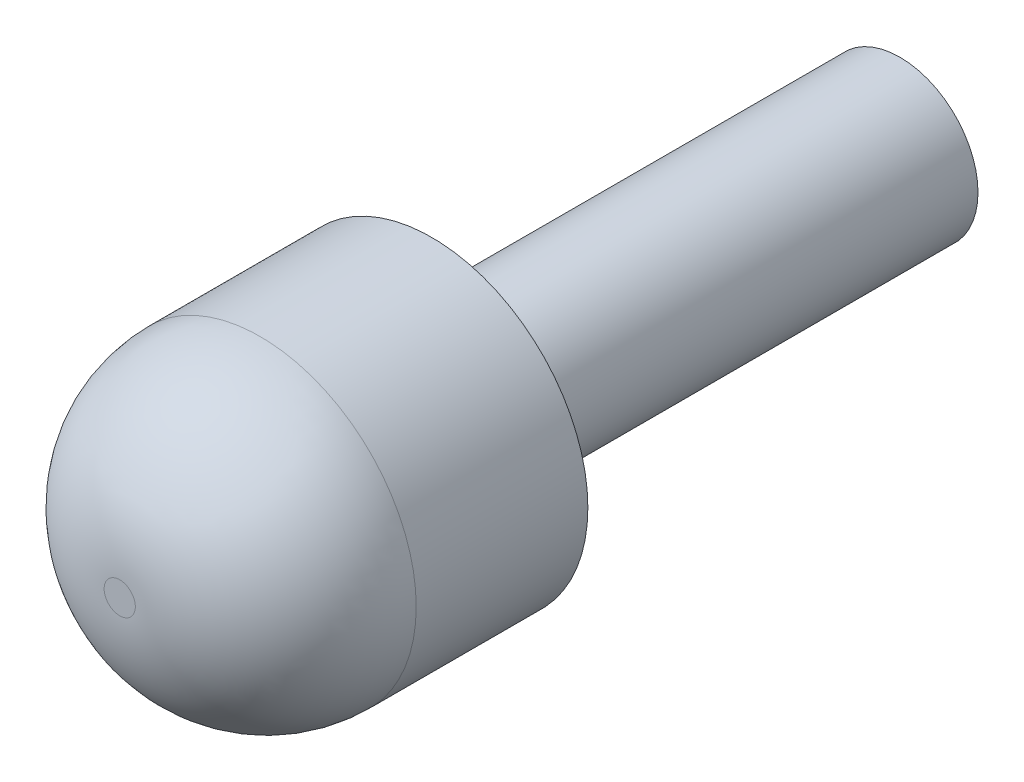
from build123d import *

# Parameters (mm, degrees)
SKETCH1_R           = 2
BASE_EXTRUDE_DEPTH  = 4
FILLET1_R           = 1.8
SKETCH2_R           = 1
BOSS_EXTRUDE1_DEPTH = 6
SKETCH3_W           = 1
SKETCH3_H           = 1
CUT_EXTRUDE1_DEPTH  = 1


with BuildPart() as part:
    # Sketch1 → Base-Extrude (new body)
    with BuildSketch(Plane.XY):
        Circle(SKETCH1_R)
    extrude(amount=-BASE_EXTRUDE_DEPTH)

    # Fillet1
    fillet1_edges = [part.edges().sort_by_distance(p)[0] for p in [
        (-2, 0, 0),
    ]]
    fillet(fillet1_edges, radius=FILLET1_R)

    # Sketch2 → Boss-Extrude1 (add)
    with BuildSketch(Plane(origin=(0, 0, -4), x_dir=(-1, 0, 0), z_dir=(0, 0, -1))):
        Circle(SKETCH2_R)
    extrude(amount=BOSS_EXTRUDE1_DEPTH)

    # Sketch3 → Cut-Extrude1 (cut)
    with BuildSketch(Plane(origin=(0, 0, -10), x_dir=(-1, 0, 0), z_dir=(0, 0, -1))):
        Rectangle(SKETCH3_W, SKETCH3_H)
    extrude(amount=-CUT_EXTRUDE1_DEPTH, mode=Mode.SUBTRACT)


solid = part.part
